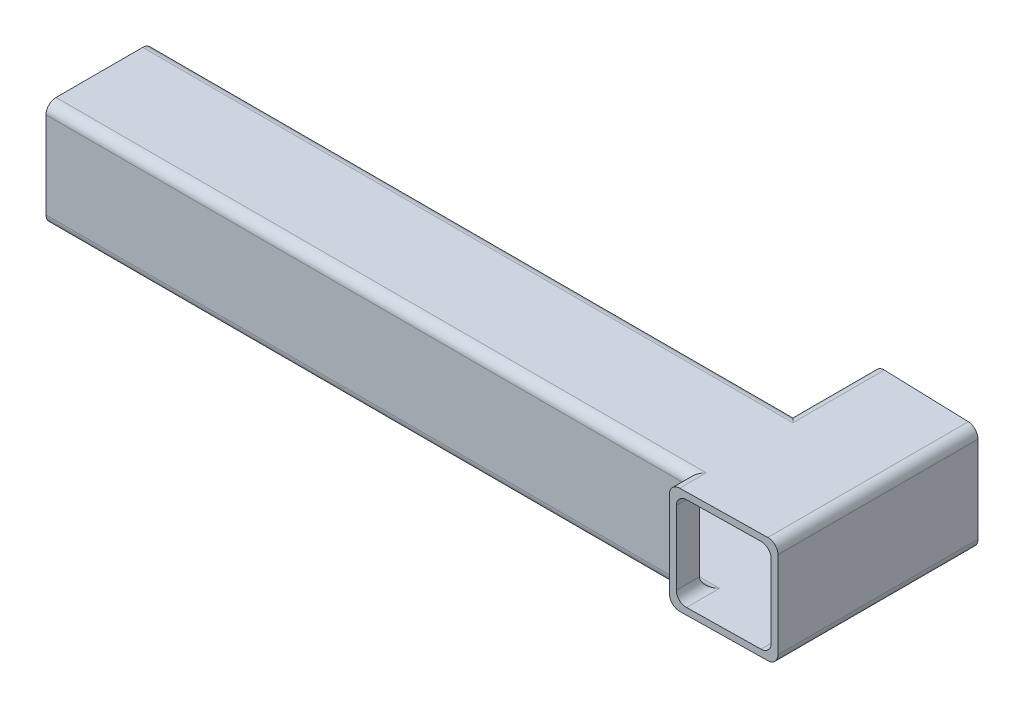
from build123d import *

# Parameters (mm, degrees)
SKETCH1_W                = 50.8
SKETCH1_H                = 50.8
SKETCH1_W_2              = 44.45
SKETCH1_H_2              = 44.45
BOSS_EXTRUDE1_DEPTH      = 304.8
BOSS_EXTRUDE2_DEPTH      = 7.9375
BOSS_EXTRUDE2_DEPTH_BACK = 89.69375
SKETCH2_W                = 50.8254
SKETCH2_H                = 50.8
SKETCH2_W_2              = 44.4754
SKETCH2_H_2              = 44.45
CUT_EXTRUDE1_DEPTH       = 371.251267642
FILLET1_R                = 4.7625
CUT_EXTRUDE2_REACH       = 369.628
SKETCH1_3_W              = 44.45
SKETCH1_3_H              = 44.45
FILLET3_R                = 4.7625


with BuildPart() as part:
    # Sketch1 → Boss-Extrude1 (new body)
    with BuildSketch(Plane(origin=(0, 0, 0), x_dir=(0, 0, -1), z_dir=(1, 0, 0))):
        with Locations((25.4, 0)):
            Rectangle(SKETCH1_W, SKETCH1_H)
        with Locations((25.4, 0)):
            Rectangle(SKETCH1_W_2, SKETCH1_H_2, mode=Mode.SUBTRACT)
    extrude(amount=BOSS_EXTRUDE1_DEPTH)

    # Sketch2 → Boss-Extrude2 (add, two sides: drawn at the far end of the back side and taken through both)
    with BuildSketch(Plane.XY.offset(-BOSS_EXTRUDE2_DEPTH_BACK)):
        with Locations((330.2, 0)):
            Rectangle(SKETCH2_W, SKETCH2_H)
        with Locations((330.2, 0)):
            Rectangle(SKETCH2_W_2, SKETCH2_H_2, mode=Mode.SUBTRACT)
    extrude(amount=BOSS_EXTRUDE2_DEPTH + BOSS_EXTRUDE2_DEPTH_BACK)

    # Sketch3 → Cut-Extrude1 (cut, through all)
    with BuildSketch(Plane(origin=(0, 25.4, 0), x_dir=(1, 0, 0), z_dir=(0, 1, 0))):
        Polygon((304.7873, 89.69375), (355.6127, 88.10625), (355.6127, 89.69375), align=None)
        Polygon((304.7873, -7.9375), (355.6127, -7.14375), (355.6127, -7.9375), align=None)
    extrude(amount=-CUT_EXTRUDE1_DEPTH, mode=Mode.SUBTRACT)

    # Fillet1
    fillet1_edges = [part.edges().sort_by_distance(p)[0] for p in [
        (152.39365, -25.4, 0),
        (152.39365, -25.4, -50.8),
        (152.39365, 25.4, -50.8),
        (152.39365, 25.4, 0),
        (304.7873, 25.4, -70.246875),
        (355.6127, 25.4, -40.48125),
        (355.6127, -25.4, -40.48125),
        (304.7873, -25.4, -70.246875),
        (304.7873, 25.4, 3.96875),
        (304.7873, -25.4, 3.96875),
    ]]
    fillet(fillet1_edges, radius=FILLET1_R)

    # Sketch1<3> → Cut-Extrude2 (cut, up to next)
    with BuildSketch(Plane(origin=(0, 0, 0), x_dir=(0, 0, -1), z_dir=(1, 0, 0)), mode=Mode.PRIVATE) as cut_extrude2_sk1:
        with Locations((25.4, 0)):
            Rectangle(SKETCH1_3_W, SKETCH1_3_H)
    cut_extrude2_tool1 = extrude(cut_extrude2_sk1.sketch, amount=CUT_EXTRUDE2_REACH, mode=Mode.PRIVATE) & part.part
    add(cut_extrude2_tool1.solids().sort_by_distance((0, 0, -25.4))[0], mode=Mode.SUBTRACT)

    # Fillet3
    fillet3_edges = [part.edges().sort_by_distance(p)[0] for p in [
        (352.4377, -22.225, -40.506042291),
        (352.4377, 22.225, -40.506042291),
        (307.9623, 22.225, -68.609790417),
        (307.9623, 22.225, 2.356457709),
        (307.9623, -22.225, 2.356457709),
        (307.9623, -22.225, -68.609790417),
        (153.98115, -22.225, -3.175),
        (153.98115, -22.225, -47.625),
        (153.98115, 22.225, -47.625),
        (153.98115, 22.225, -3.175),
    ]]
    fillet(fillet3_edges, radius=FILLET3_R)


solid = part.part
